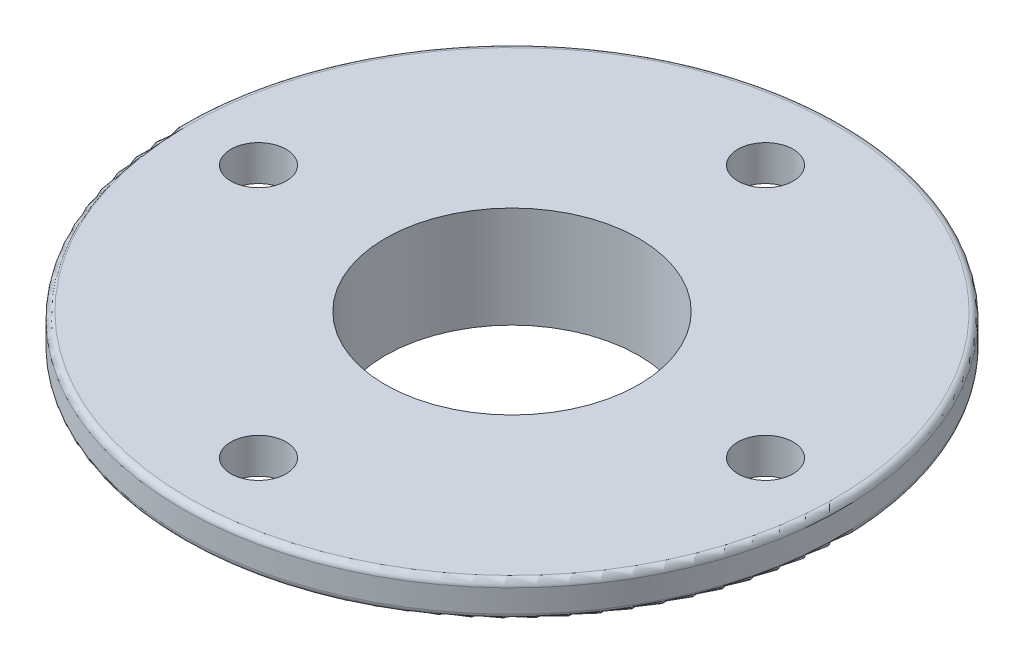
from build123d import *

# Parameters (mm, degrees)
SKETCH1_R           = 7
SKETCH1_R_2         = 5
BOSS_EXTRUDE1_DEPTH = 2.6
SKETCH2_R           = 13
SKETCH2_R_2         = 5
BOSS_EXTRUDE2_DEPTH = 1.4
SKETCH3_R           = 1.09
CUT_EXTRUDE1_DEPTH  = 19.814887722
CIRPATTERN1_COUNT   = 4
FILLET1_R           = 0.25


with BuildPart() as part:
    # Sketch1 → Boss-Extrude1 (new body)
    with BuildSketch(Plane(origin=(0, 0, 0), x_dir=(1, 0, 0), z_dir=(0, 1, 0))):
        Circle(SKETCH1_R)
        Circle(SKETCH1_R_2, mode=Mode.SUBTRACT)
    extrude(amount=BOSS_EXTRUDE1_DEPTH)

    # Sketch2 → Boss-Extrude2 (add)
    with BuildSketch(Plane(origin=(0, 2.6, 0), x_dir=(1, 0, 0), z_dir=(0, 1, 0))):
        Circle(SKETCH2_R)
        Circle(SKETCH2_R_2, mode=Mode.SUBTRACT)
    extrude(amount=BOSS_EXTRUDE2_DEPTH)

    # Sketch3 → Cut-Extrude1 (cut, through all)
    with BuildSketch(Plane(origin=(0, 4, 0), x_dir=(1, 0, 0), z_dir=(0, 1, 0))):
        with Locations((0, 10)):
            Circle(SKETCH3_R)
    cut_extrude1 = extrude(amount=-CUT_EXTRUDE1_DEPTH, mode=Mode.SUBTRACT)

    # CirPattern1: Cut-Extrude1 ×4 about axis
    cirpattern1_axis = Axis((0, 2.6, 0), (0, -1, 0))
    for i in range(1, CIRPATTERN1_COUNT):
        add(cut_extrude1.rotate(cirpattern1_axis, i * 360 / CIRPATTERN1_COUNT), mode=Mode.SUBTRACT)

    # Fillet1
    fillet1_edges = [part.edges().sort_by_distance(p)[0] for p in [
        (-13, 4, 0),
        (-13, 2.6, 0),
    ]]
    fillet(fillet1_edges, radius=FILLET1_R)


solid = part.part
